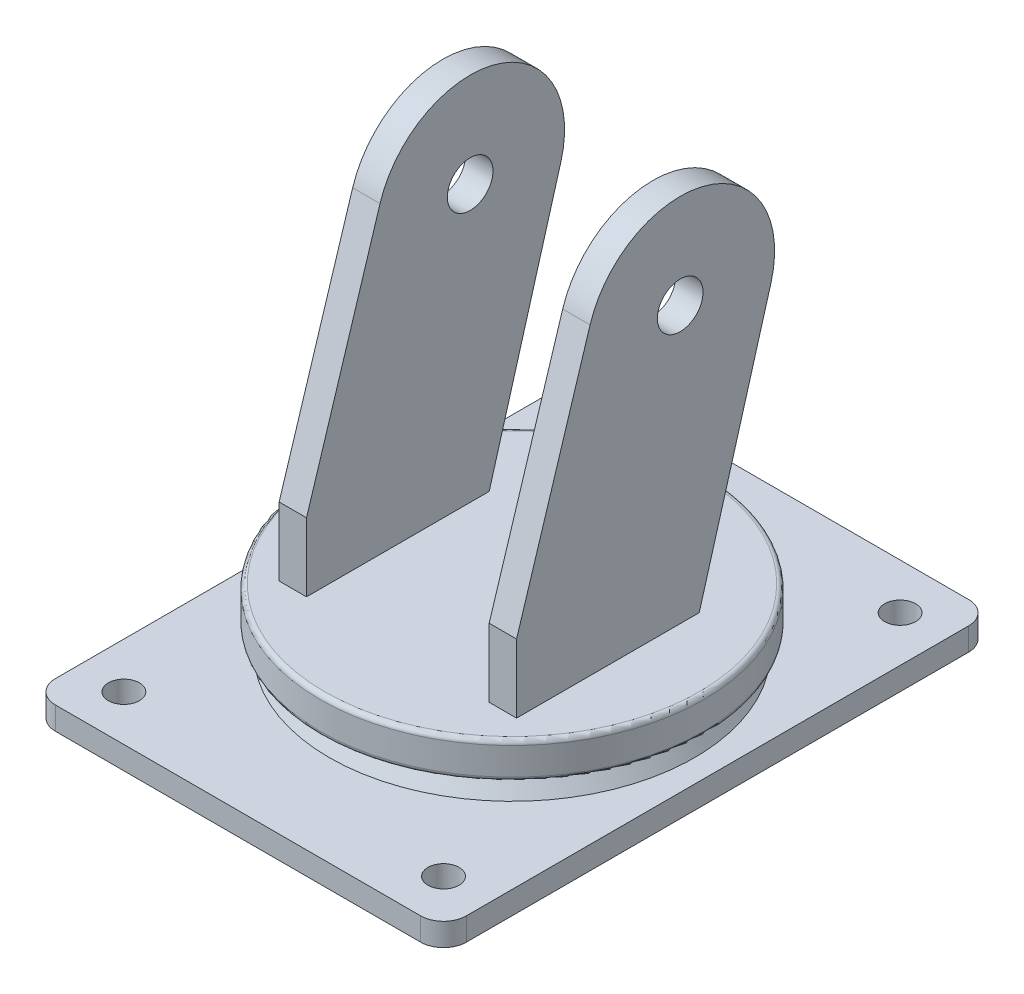
from build123d import *

# Parameters (mm, degrees)
SKETCH_1_W          = 90
SKETCH_1_H          = 120
EXTRUDE_1_DEPTH     = 5
FILLET_3_R          = 5
SKETCH_21_R         = 17.5
CUT_EXTRUDE_1_DEPTH = 2
FILLET_4_R          = 0.5
SKETCH_22_R         = 16.5
EXTRUDE_2_DEPTH     = 2
FILLET_5_R          = 2
FILLET_6_R          = 0.5
SKETCH_27_R         = 42
EXTRUDE_4_DEPTH     = 8
EXTRUDE_5_DEPTH     = 6
SKETCH_31_R         = 5
CUT_EXTRUDE_2_DEPTH = 85
FILLET_7_R          = 1
FILLET_8_R          = 1


with BuildPart() as part:
    # 草图1 → 凸台-拉伸1 (new body)
    with BuildSketch(Plane(origin=(0, 0, 0), x_dir=(1, 0, 0), z_dir=(0, 1, 0))):
        Rectangle(SKETCH_1_W, SKETCH_1_H)
    extrude(amount=EXTRUDE_1_DEPTH)

    # 圆角3
    fillet_3_edges = [part.edges().sort_by_distance(p)[0] for p in [
        (45, 2.5, 60),
        (-45, 2.5, 60),
        (-45, 2.5, -60),
        (45, 2.5, -60),
    ]]
    fillet(fillet_3_edges, radius=FILLET_3_R)

    # 草图17 → M8 螺纹孔1 (revolve, cut)
    with BuildSketch(Plane(origin=(-35, 5, -50), x_dir=(0, 0, 1), z_dir=(1, 0, 0))):
        Polygon((0, 0), (0, 21.792926105), (3.4, 19.75), (3.4, 0), align=None)
    hole_wizard_m8_1 = revolve(axis=Axis((-35, 11.35, -50), (0, -1, 0)), mode=Mode.SUBTRACT)

    # 镜向4: M8 螺纹孔1 across plane
    add(hole_wizard_m8_1.mirror(Plane(origin=(0, 0, 0), x_dir=(0, 0, 1), z_dir=(1, 0, 0))), mode=Mode.SUBTRACT)

    # 镜向5: M8 螺纹孔1 across plane
    add(hole_wizard_m8_1.mirror(Plane.XY), mode=Mode.SUBTRACT)

    # 镜向5 copy 1 sketch → 镜向5 copy 1 (revolve, cut)
    with BuildSketch(Plane(origin=(35, 5, 50), x_dir=(0, 0, -1), z_dir=(-1, 0, 0))):
        Polygon((0, 0), (0, 21.792926105), (3.4, 19.75), (3.4, 0), align=None)
    revolve(axis=Axis((35, 11.35, 50), (0, -1, 0)), mode=Mode.SUBTRACT)

    # 草图21 → 切除-拉伸1 (cut)
    with BuildSketch(Plane.XZ):
        with Locations(Location((0, 0, 0), (0, 0, 270))):
            Circle(SKETCH_21_R)
    extrude(amount=-CUT_EXTRUDE_1_DEPTH, mode=Mode.SUBTRACT)

    # 圆角4
    fillet_4_edges = [part.edges().sort_by_distance(p)[0] for p in [
        (0, 0, 17.5),
    ]]
    fillet(fillet_4_edges, radius=FILLET_4_R)

    # 草图22 → 凸台-拉伸2 (add)
    with BuildSketch(Plane.XZ.offset(-2)):
        with Locations(Location((0, 0, 0), (0, 0, 270))):
            Circle(SKETCH_22_R)
    extrude(amount=EXTRUDE_2_DEPTH)

    # 圆角5
    fillet_5_edges = [part.edges().sort_by_distance(p)[0] for p in [
        (0, 0, 16.5),
    ]]
    fillet(fillet_5_edges, radius=FILLET_5_R - 0.0001)  # a hair under: the kernel refuses the full size

    # 圆角6
    fillet_6_edges = [part.edges().sort_by_distance(p)[0] for p in [
        (0, 2, 17.5),
    ]]
    fillet(fillet_6_edges, radius=FILLET_6_R)

    # 草图26 → 旋转1 (revolve)
    with BuildSketch(Plane(origin=(0, 0, 0), x_dir=(0, 0, -1), z_dir=(1, 0, 0))):
        Polygon((0, 5), (-40, 5), (-37, 10), (0, 10), align=None)
    revolve(axis=Axis((0, 10, 0), (0, -1, 0)))

    # 草图27 → 凸台-拉伸4 (add)
    with BuildSketch(Plane(origin=(0, 10, 0), x_dir=(1, 0, 0), z_dir=(0, 1, 0))):
        with Locations(Location((0, 0, 0), (0, 0, 270))):
            Circle(SKETCH_27_R)
    extrude(amount=EXTRUDE_4_DEPTH)

    # 草图30 → 凸台-拉伸5 (add)
    with BuildSketch(Plane(origin=(20, 0, 0), x_dir=(0, 0, -1), z_dir=(1, 0, 0))):
        with BuildLine():
            Line((0, 18), (15, 18))
            Line((15, 18), (30.712075667, 72.659714105))
            ThreePointArc((30.712075667, 72.659714105), (16.777367703, 98.180524284), (-8.901037595, 84.538407896))
            Line((-8.901037595, 84.538407896), (-25, 33))
            Line((-25, 33), (-25, 18))
            Line((-25, 18), (0, 18))
        make_face()
    extrude_5 = extrude(amount=EXTRUDE_5_DEPTH)

    # 镜向6: 凸台-拉伸5 across plane
    add(extrude_5.mirror(Plane(origin=(0, 0, 0), x_dir=(0, 0, 1), z_dir=(1, 0, 0))))

    # 草图31 → 切除-拉伸2 (cut)
    with BuildSketch(Plane(origin=(26, 0, 0), x_dir=(0, 0, -1), z_dir=(1, 0, 0))):
        with Locations(Location((10.837632854, 78.372673904, 0), (0, 0, 180))):
            Circle(SKETCH_31_R)
    extrude(amount=-CUT_EXTRUDE_2_DEPTH, mode=Mode.SUBTRACT)

    # 圆角7
    fillet_7_edges = [part.edges().sort_by_distance(p)[0] for p in [
        (0, 10, -42),
    ]]
    fillet(fillet_7_edges, radius=FILLET_7_R)

    # 圆角8
    fillet_8_edges = [part.edges().sort_by_distance(p)[0] for p in [
        (0, 18, -42),
    ]]
    fillet(fillet_8_edges, radius=FILLET_8_R)


solid = part.part
